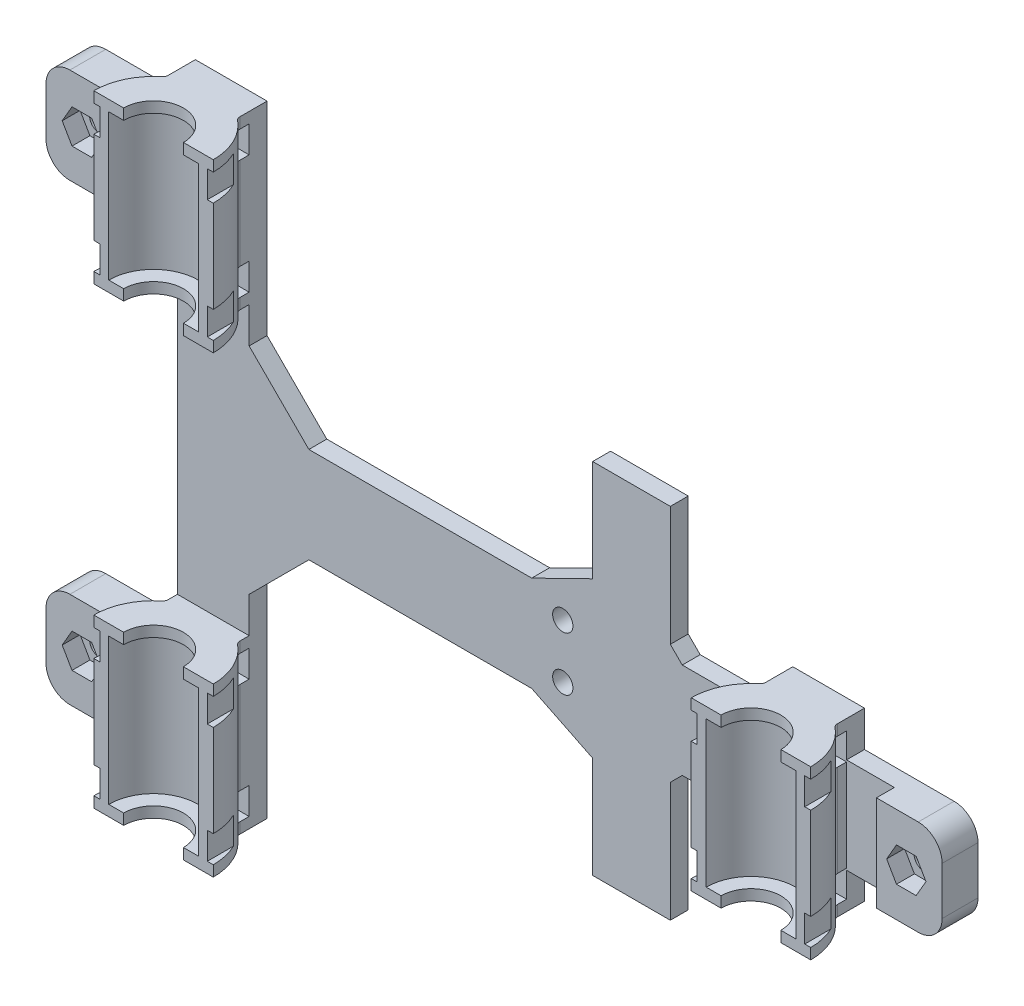
from build123d import *

# Parameters (mm, degrees)
SKETCH_1_W           = 150
SKETCH_1_H           = 140
EXTRUDE_1_DEPTH      = 3
EXTRUDE_2_DEPTH      = 14
EXTRUDE_2_DEPTH_BACK = 14
EXTRUDE_START        = 38
EXTRUDE_3_DEPTH      = 14
EXTRUDE_START_2      = 52
EXTRUDE_5_DEPTH      = 1.8
EXTRUDE_START_3      = 24
EXTRUDE_6_DEPTH      = 1.8
EXTRUDE_START_4      = 12.2
EXTRUDE_7_DEPTH      = 1.8
EXTRUDE_START_5      = -14
EXTRUDE_8_DEPTH      = 1.8
EXTRUDE_START_6      = -52
EXTRUDE_9_DEPTH      = 1.8
EXTRUDE_START_7      = -25.8
EXTRUDE_10_DEPTH     = 1.8
FILLET_1_R           = 1
CUT_EXTRUDE_5_REACH  = 105.412
SKETCH_5_W           = 1
SKETCH_5_H           = 4.5
CUT_EXTRUDE_6_REACH  = 105.078
SKETCH_3_9_R         = 1.7
CUT_EXTRUDE_7_DEPTH  = 10
EXTRUDE_START_8      = 3
SKETCH_3_12_W        = 10.254153824
SKETCH_3_12_H        = 16
EXTRUDE_11_DEPTH     = 3
CUT_EXTRUDE_START    = -15
SKETCH_6_W           = 2
SKETCH_6_H           = 4.5
CUT_EXTRUDE_8_DEPTH  = 20
CUT_EXTRUDE_START_2  = -115
SKETCH_6_3_W         = 2
SKETCH_6_3_H         = 4.5
CUT_EXTRUDE_9_DEPTH  = 20
CHAMFER_2_SIZE       = 2
FILLET_2_R           = 4
EXTRUDE_12_DEPTH     = 24
CUT_EXTRUDE_10_DEPTH = 10
SKETCH_8_W           = 8
SKETCH_8_H           = 2.4
CUT_EXTRUDE_11_DEPTH = 10
CHAMFER_1_SIZE       = 10.2
CHAMFER_1_SIZE2      = 5
CHAMFER_3_SIZE       = 5
CHAMFER_3_SIZE2      = 10.2
SKETCH_9_OUTSIDE_W   = 188.902
SKETCH_9_OUTSIDE_H   = 65.902
CUT_EXTRUDE_13_DEPTH = 132.034346642


with BuildPart() as part:
    # 草图1 → 凸台-拉伸1 (new body)
    with BuildSketch(Plane.XY):
        Rectangle(SKETCH_1_W, SKETCH_1_H)
    extrude(amount=EXTRUDE_1_DEPTH)

    # 草图2 → 凸台-拉伸2 (add, two sides: drawn at the far end of the back side and taken through both)
    with BuildSketch(Plane(origin=(0, 0, 0), x_dir=(1, 0, 0), z_dir=(0, 1, 0)).offset(-EXTRUDE_2_DEPTH_BACK)):
        with BuildLine():
            Line((56, -5), (56, -3))
            Line((56, -3), (44, -3))
            Line((44, -3), (44, -5))
            ThreePointArc((44, -5), (41.05572809, -8.527864045), (40, -13))
            Line((40, -13), (42.5, -13))
            ThreePointArc((42.5, -13), (50, -5.5), (57.5, -13))
            Line((57.5, -13), (60, -13))
            ThreePointArc((60, -13), (58.94427191, -8.527864045), (56, -5))
        make_face()
    extrude(amount=EXTRUDE_2_DEPTH + EXTRUDE_2_DEPTH_BACK)

    # 草图2<3> → 凸台-拉伸3 (add, symmetric)
    with BuildSketch(Plane(origin=(0, 0, 0), x_dir=(1, 0, 0), z_dir=(0, 1, 0)).offset(EXTRUDE_START)):
        with BuildLine():
            Line((-60, -13), (-57.5, -13))
            ThreePointArc((-57.5, -13), (-50, -5.5), (-42.5, -13))
            Line((-42.5, -13), (-40, -13))
            ThreePointArc((-40, -13), (-41.05572809, -8.527864045), (-44, -5))
            Line((-44, -5), (-44, -3))
            Line((-44, -3), (-56, -3))
            Line((-56, -3), (-56, -5))
            ThreePointArc((-56, -5), (-58.94427191, -8.527864045), (-60, -13))
        make_face()
    extrude_3 = extrude(amount=EXTRUDE_3_DEPTH, both=True)

    # 草图2<4> → 凸台-拉伸5 (add)
    with BuildSketch(Plane(origin=(0, 0, 0), x_dir=(1, 0, 0), z_dir=(0, 1, 0)).offset(EXTRUDE_START_2)):
        with BuildLine():
            Line((-55, -13), (-57.5, -13))
            ThreePointArc((-57.5, -13), (-50, -5.5), (-42.5, -13))
            Line((-42.5, -13), (-45, -13))
            ThreePointArc((-45, -13), (-50, -8), (-55, -13))
        make_face()
    extrude(amount=-EXTRUDE_5_DEPTH)

    # 草图2<5> → 凸台-拉伸6 (add)
    with BuildSketch(Plane(origin=(0, 0, 0), x_dir=(1, 0, 0), z_dir=(0, 1, 0)).offset(EXTRUDE_START_3)):
        with BuildLine():
            Line((-55, -13), (-57.5, -13))
            ThreePointArc((-57.5, -13), (-50, -5.5), (-42.5, -13))
            Line((-42.5, -13), (-45, -13))
            ThreePointArc((-45, -13), (-50, -8), (-55, -13))
        make_face()
    extrude(amount=EXTRUDE_6_DEPTH)

    # 草图2<6> → 凸台-拉伸7 (add)
    with BuildSketch(Plane(origin=(0, 0, 0), x_dir=(1, 0, 0), z_dir=(0, 1, 0)).offset(EXTRUDE_START_4)):
        with BuildLine():
            Line((55, -13), (57.5, -13))
            ThreePointArc((57.5, -13), (50, -5.5), (42.5, -13))
            Line((42.5, -13), (45, -13))
            ThreePointArc((45, -13), (50, -8), (55, -13))
        make_face()
    extrude(amount=EXTRUDE_7_DEPTH)

    # 镜向5: 凸台-拉伸3 across plane
    add(extrude_3.mirror(Plane.ZX))

    # 草图2<7> → 凸台-拉伸8 (add)
    with BuildSketch(Plane(origin=(0, 0, 0), x_dir=(1, 0, 0), z_dir=(0, 1, 0)).offset(EXTRUDE_START_5)):
        with BuildLine():
            Line((55, -13), (57.5, -13))
            ThreePointArc((57.5, -13), (50, -5.5), (42.5, -13))
            Line((42.5, -13), (45, -13))
            ThreePointArc((45, -13), (50, -8), (55, -13))
        make_face()
    extrude(amount=EXTRUDE_8_DEPTH)

    # 草图2<8> → 凸台-拉伸9 (add)
    with BuildSketch(Plane(origin=(0, 0, 0), x_dir=(1, 0, 0), z_dir=(0, 1, 0)).offset(EXTRUDE_START_6)):
        with BuildLine():
            Line((-55, -13), (-57.5, -13))
            ThreePointArc((-57.5, -13), (-50, -5.5), (-42.5, -13))
            Line((-42.5, -13), (-45, -13))
            ThreePointArc((-45, -13), (-50, -8), (-55, -13))
        make_face()
    extrude(amount=EXTRUDE_9_DEPTH)

    # 草图2<9> → 凸台-拉伸10 (add)
    with BuildSketch(Plane(origin=(0, 0, 0), x_dir=(1, 0, 0), z_dir=(0, 1, 0)).offset(EXTRUDE_START_7)):
        with BuildLine():
            Line((-55, -13), (-57.5, -13))
            ThreePointArc((-57.5, -13), (-50, -5.5), (-42.5, -13))
            Line((-42.5, -13), (-45, -13))
            ThreePointArc((-45, -13), (-50, -8), (-55, -13))
        make_face()
    extrude(amount=EXTRUDE_10_DEPTH)

    # 圆角1
    fillet_1_edges = [part.edges().sort_by_distance(p)[0] for p in [
        (56, 0, 5),
        (44, 0, 5),
        (-44, 38, 5),
        (-56, 38, 5),
        (-56, -38, 5),
        (-44, -38, 5),
    ]]
    fillet(fillet_1_edges, radius=FILLET_1_R)

    # 草图5 → 切除-拉伸5 (cut, up to next)
    with BuildSketch(Plane.XY.offset(13), mode=Mode.PRIVATE) as cut_extrude_5_sk1:
        with Locations((59.5, 9.95)):
            Rectangle(SKETCH_5_W, SKETCH_5_H)
    cut_extrude_5_tool1 = extrude(cut_extrude_5_sk1.sketch, amount=-CUT_EXTRUDE_5_REACH, mode=Mode.PRIVATE) & part.part
    # 草图5 → 切除-拉伸5 (cut, up to next)
    with BuildSketch(Plane.XY.offset(13), mode=Mode.PRIVATE) as cut_extrude_5_sk2:
        with Locations((59.5, -9.95)):
            Rectangle(SKETCH_5_W, SKETCH_5_H)
    cut_extrude_5_tool2 = extrude(cut_extrude_5_sk2.sketch, amount=-CUT_EXTRUDE_5_REACH, mode=Mode.PRIVATE) & part.part
    # 草图5 → 切除-拉伸5 (cut, up to next)
    with BuildSketch(Plane.XY.offset(13), mode=Mode.PRIVATE) as cut_extrude_5_sk3:
        with Locations((-59.5, 47.95)):
            Rectangle(SKETCH_5_W, SKETCH_5_H)
    cut_extrude_5_tool3 = extrude(cut_extrude_5_sk3.sketch, amount=-CUT_EXTRUDE_5_REACH, mode=Mode.PRIVATE) & part.part
    # 草图5 → 切除-拉伸5 (cut, up to next)
    with BuildSketch(Plane.XY.offset(13), mode=Mode.PRIVATE) as cut_extrude_5_sk4:
        with Locations((-59.5, 28.05)):
            Rectangle(SKETCH_5_W, SKETCH_5_H)
    cut_extrude_5_tool4 = extrude(cut_extrude_5_sk4.sketch, amount=-CUT_EXTRUDE_5_REACH, mode=Mode.PRIVATE) & part.part
    # 草图5 → 切除-拉伸5 (cut, up to next)
    with BuildSketch(Plane.XY.offset(13), mode=Mode.PRIVATE) as cut_extrude_5_sk5:
        with Locations((-59.5, -28.05)):
            Rectangle(SKETCH_5_W, SKETCH_5_H)
    cut_extrude_5_tool5 = extrude(cut_extrude_5_sk5.sketch, amount=-CUT_EXTRUDE_5_REACH, mode=Mode.PRIVATE) & part.part
    # 草图5 → 切除-拉伸5 (cut, up to next)
    with BuildSketch(Plane.XY.offset(13), mode=Mode.PRIVATE) as cut_extrude_5_sk6:
        with Locations((-59.5, -47.95)):
            Rectangle(SKETCH_5_W, SKETCH_5_H)
    cut_extrude_5_tool6 = extrude(cut_extrude_5_sk6.sketch, amount=-CUT_EXTRUDE_5_REACH, mode=Mode.PRIVATE) & part.part
    # 草图5 → 切除-拉伸5 (cut, up to next)
    with BuildSketch(Plane.XY.offset(13), mode=Mode.PRIVATE) as cut_extrude_5_sk7:
        with Locations((-40.5, -47.95)):
            Rectangle(SKETCH_5_W, SKETCH_5_H)
    cut_extrude_5_tool7 = extrude(cut_extrude_5_sk7.sketch, amount=-CUT_EXTRUDE_5_REACH, mode=Mode.PRIVATE) & part.part
    # 草图5 → 切除-拉伸5 (cut, up to next)
    with BuildSketch(Plane.XY.offset(13), mode=Mode.PRIVATE) as cut_extrude_5_sk8:
        with Locations((-40.5, -28.05)):
            Rectangle(SKETCH_5_W, SKETCH_5_H)
    cut_extrude_5_tool8 = extrude(cut_extrude_5_sk8.sketch, amount=-CUT_EXTRUDE_5_REACH, mode=Mode.PRIVATE) & part.part
    # 草图5 → 切除-拉伸5 (cut, up to next)
    with BuildSketch(Plane.XY.offset(13), mode=Mode.PRIVATE) as cut_extrude_5_sk9:
        with Locations((-40.5, 28.05)):
            Rectangle(SKETCH_5_W, SKETCH_5_H)
    cut_extrude_5_tool9 = extrude(cut_extrude_5_sk9.sketch, amount=-CUT_EXTRUDE_5_REACH, mode=Mode.PRIVATE) & part.part
    # 草图5 → 切除-拉伸5 (cut, up to next)
    with BuildSketch(Plane.XY.offset(13), mode=Mode.PRIVATE) as cut_extrude_5_sk10:
        with Locations((-40.5, 47.95)):
            Rectangle(SKETCH_5_W, SKETCH_5_H)
    cut_extrude_5_tool10 = extrude(cut_extrude_5_sk10.sketch, amount=-CUT_EXTRUDE_5_REACH, mode=Mode.PRIVATE) & part.part
    # 草图5 → 切除-拉伸5 (cut, up to next)
    with BuildSketch(Plane.XY.offset(13), mode=Mode.PRIVATE) as cut_extrude_5_sk11:
        with Locations((40.5, -9.95)):
            Rectangle(SKETCH_5_W, SKETCH_5_H)
    cut_extrude_5_tool11 = extrude(cut_extrude_5_sk11.sketch, amount=-CUT_EXTRUDE_5_REACH, mode=Mode.PRIVATE) & part.part
    # 草图5 → 切除-拉伸5 (cut, up to next)
    with BuildSketch(Plane.XY.offset(13), mode=Mode.PRIVATE) as cut_extrude_5_sk12:
        with Locations((40.5, 9.95)):
            Rectangle(SKETCH_5_W, SKETCH_5_H)
    cut_extrude_5_tool12 = extrude(cut_extrude_5_sk12.sketch, amount=-CUT_EXTRUDE_5_REACH, mode=Mode.PRIVATE) & part.part
    add(cut_extrude_5_tool1.solids().sort_by_distance((59.5, 9.95, 13))[0], mode=Mode.SUBTRACT)
    add(cut_extrude_5_tool2.solids().sort_by_distance((59.5, -9.95, 13))[0], mode=Mode.SUBTRACT)
    add(cut_extrude_5_tool3.solids().sort_by_distance((-59.5, 47.95, 13))[0], mode=Mode.SUBTRACT)
    add(cut_extrude_5_tool4.solids().sort_by_distance((-59.5, 28.05, 13))[0], mode=Mode.SUBTRACT)
    add(cut_extrude_5_tool5.solids().sort_by_distance((-59.5, -28.05, 13))[0], mode=Mode.SUBTRACT)
    add(cut_extrude_5_tool6.solids().sort_by_distance((-59.5, -47.95, 13))[0], mode=Mode.SUBTRACT)
    add(cut_extrude_5_tool7.solids().sort_by_distance((-40.5, -47.95, 13))[0], mode=Mode.SUBTRACT)
    add(cut_extrude_5_tool8.solids().sort_by_distance((-40.5, -28.05, 13))[0], mode=Mode.SUBTRACT)
    add(cut_extrude_5_tool9.solids().sort_by_distance((-40.5, 28.05, 13))[0], mode=Mode.SUBTRACT)
    add(cut_extrude_5_tool10.solids().sort_by_distance((-40.5, 47.95, 13))[0], mode=Mode.SUBTRACT)
    add(cut_extrude_5_tool11.solids().sort_by_distance((40.5, -9.95, 13))[0], mode=Mode.SUBTRACT)
    add(cut_extrude_5_tool12.solids().sort_by_distance((40.5, 9.95, 13))[0], mode=Mode.SUBTRACT)

    # 草图3 → 切除-拉伸6 (cut, up to next)
    with BuildSketch(Plane.XY.offset(3), mode=Mode.PRIVATE) as cut_extrude_6_sk1:
        with BuildLine():
            Line((-56, 46), (-56, 52))
            Line((-56, 52), (-44, 52))
            Line((-44, 52), (-44, 18))
            Line((-44, 18), (-34, 8))
            Line((-34, 8), (13.5, 8))
            Line((13.5, 8), (13.5, 30))
            Line((13.5, 30), (26.5, 30))
            Line((26.5, 30), (26.5, 8))
            Line((26.5, 8), (44, 8))
            Line((44, 8), (44, 14))
            Line((44, 14), (56, 14))
            Line((56, 14), (56, 8))
            Line((56, 8), (71, 8))
            ThreePointArc((71, 8), (73.828427125, 6.828427125), (75, 4))
            Line((75, 4), (75, 70))
            Line((75, 70), (-75, 70))
            Line((-75, 70), (-75, 42))
            ThreePointArc((-75, 42), (-73.828427125, 44.828427125), (-71, 46))
            Line((-71, 46), (-56, 46))
        make_face()
    cut_extrude_6_tool1 = extrude(cut_extrude_6_sk1.sketch, amount=-CUT_EXTRUDE_6_REACH, mode=Mode.PRIVATE) & part.part
    # 草图3 → 切除-拉伸6 (cut, up to next)
    with BuildSketch(Plane.XY.offset(3), mode=Mode.PRIVATE) as cut_extrude_6_sk2:
        with BuildLine():
            Line((-56, -30), (-56, 30))
            Line((-56, 30), (-71, 30))
            ThreePointArc((-71, 30), (-73.828427125, 31.171572875), (-75, 34))
            Line((-75, 34), (-75, -34))
            ThreePointArc((-75, -34), (-73.828427125, -31.171572875), (-71, -30))
            Line((-71, -30), (-56, -30))
        make_face()
    cut_extrude_6_tool2 = extrude(cut_extrude_6_sk2.sketch, amount=-CUT_EXTRUDE_6_REACH, mode=Mode.PRIVATE) & part.part
    # 草图3 → 切除-拉伸6 (cut, up to next)
    with BuildSketch(Plane.XY.offset(3), mode=Mode.PRIVATE) as cut_extrude_6_sk3:
        with BuildLine():
            Line((-44, -18), (-44, -52))
            Line((-44, -52), (-56, -52))
            Line((-56, -52), (-56, -46))
            Line((-56, -46), (-71, -46))
            ThreePointArc((-71, -46), (-73.828427125, -44.828427125), (-75, -42))
            Line((-75, -42), (-75, -70))
            Line((-75, -70), (75, -70))
            Line((75, -70), (75, -4))
            ThreePointArc((75, -4), (73.828427125, -6.828427125), (71, -8))
            Line((71, -8), (56, -8))
            Line((56, -8), (56, -14))
            Line((56, -14), (44, -14))
            Line((44, -14), (44, -8))
            Line((44, -8), (26.5, -8))
            Line((26.5, -8), (26.5, -30))
            Line((26.5, -30), (13.5, -30))
            Line((13.5, -30), (13.5, -8))
            Line((13.5, -8), (-34, -8))
            Line((-34, -8), (-44, -18))
        make_face()
    cut_extrude_6_tool3 = extrude(cut_extrude_6_sk3.sketch, amount=-CUT_EXTRUDE_6_REACH, mode=Mode.PRIVATE) & part.part
    add(cut_extrude_6_tool1.solids().sort_by_distance((8.681591, 41.934656, 3))[0], mode=Mode.SUBTRACT)
    add(cut_extrude_6_tool2.solids().sort_by_distance((-65.551535, 0, 3))[0], mode=Mode.SUBTRACT)
    add(cut_extrude_6_tool3.solids().sort_by_distance((8.681591, -41.934656, 3))[0], mode=Mode.SUBTRACT)

    # 草图3<9> → 切除-拉伸7 (cut)
    with BuildSketch(Plane.XY.offset(3)):
        with Locations((-69, 38)):
            Circle(SKETCH_3_9_R)
        with Locations((-69, -38)):
            Circle(SKETCH_3_9_R)
        with Locations((69, 0)):
            Circle(SKETCH_3_9_R)
        with Locations((8.5, -4.5)):
            Circle(SKETCH_3_9_R)
        with Locations((8.5, 4.5)):
            Circle(SKETCH_3_9_R)
    extrude(amount=-CUT_EXTRUDE_7_DEPTH, mode=Mode.SUBTRACT)

    # 草图3<12> → 凸台-拉伸11 (add)
    # profile 1 of 4: a face of its own
    with BuildSketch(Plane.XY.offset(3).offset(EXTRUDE_START_8)):
        with BuildLine():
            Line((64, 8), (64, -8))
            Line((64, -8), (71, -8))
            ThreePointArc((71, -8), (73.828427125, -6.828427125), (75, -4))
            Line((75, -4), (75, 4))
            ThreePointArc((75, 4), (73.828427125, 6.828427125), (71, 8))
            Line((71, 8), (64, 8))
        make_face()
        Polygon((70.645448267, 2.85), (72.290896534, 0), (70.645448267, -2.85), (67.354551733, -2.85), (65.709103466, 0), (67.354551733, 2.85), align=None, mode=Mode.SUBTRACT)
    # profile 2 of 4: a face of its own
    with BuildSketch(Plane.XY.offset(3).offset(EXTRUDE_START_8)):
        with BuildLine():
            Line((-64, 30), (-64, 46))
            Line((-64, 46), (-71, 46))
            ThreePointArc((-71, 46), (-73.828427125, 44.828427125), (-75, 42))
            Line((-75, 42), (-75, 34))
            ThreePointArc((-75, 34), (-73.828427125, 31.171572875), (-71, 30))
            Line((-71, 30), (-64, 30))
        make_face()
        Polygon((-67.354551733, 40.85), (-65.709103466, 38), (-67.354551733, 35.15), (-70.645448267, 35.15), (-72.290896534, 38), (-70.645448267, 40.85), align=None, mode=Mode.SUBTRACT)
    # profile 3 of 4: a face of its own
    with BuildSketch(Plane.XY.offset(3).offset(EXTRUDE_START_8)):
        with Locations((8.372923088, 0)):
            Rectangle(SKETCH_3_12_W, SKETCH_3_12_H)
        Polygon((10.145448267, -1.65), (11.790896534, -4.5), (10.145448267, -7.35), (6.854551733, -7.35), (5.209103466, -4.5), (6.854551733, -1.65), align=None, mode=Mode.SUBTRACT)
        Polygon((6.854551733, 7.35), (10.145448267, 7.35), (11.790896534, 4.5), (10.145448267, 1.65), (6.854551733, 1.65), (5.209103466, 4.5), align=None, mode=Mode.SUBTRACT)
    # profile 4 of 4: a face of its own
    with BuildSketch(Plane.XY.offset(3).offset(EXTRUDE_START_8)):
        with BuildLine():
            Line((-64, -46), (-64, -30))
            Line((-64, -30), (-71, -30))
            ThreePointArc((-71, -30), (-73.828427125, -31.171572875), (-75, -34))
            Line((-75, -34), (-75, -42))
            ThreePointArc((-75, -42), (-73.828427125, -44.828427125), (-71, -46))
            Line((-71, -46), (-64, -46))
        make_face()
        Polygon((-70.645448267, -35.15), (-67.354551733, -35.15), (-65.709103466, -38), (-67.354551733, -40.85), (-70.645448267, -40.85), (-72.290896534, -38), align=None, mode=Mode.SUBTRACT)
    extrude(amount=-EXTRUDE_11_DEPTH)

    # 草图6 → 切除-拉伸8 (cut)
    with BuildSketch(Plane(origin=(75, 0, 0), x_dir=(0, 0, -1), z_dir=(1, 0, 0)).offset(CUT_EXTRUDE_START)):
        with Locations((-4, 9.95)):
            Rectangle(SKETCH_6_W, SKETCH_6_H)
        with Locations((-4, -9.95)):
            Rectangle(SKETCH_6_W, SKETCH_6_H)
    extrude(amount=-CUT_EXTRUDE_8_DEPTH, mode=Mode.SUBTRACT)

    # 草图6<3> → 切除-拉伸9 (cut)
    with BuildSketch(Plane(origin=(75, 0, 0), x_dir=(0, 0, -1), z_dir=(1, 0, 0)).offset(CUT_EXTRUDE_START_2)):
        with Locations((-4, 47.95)):
            Rectangle(SKETCH_6_3_W, SKETCH_6_3_H)
        with Locations((-4, 28.05)):
            Rectangle(SKETCH_6_3_W, SKETCH_6_3_H)
        with Locations((-4, -28.05)):
            Rectangle(SKETCH_6_3_W, SKETCH_6_3_H)
        with Locations((-4, -47.95)):
            Rectangle(SKETCH_6_3_W, SKETCH_6_3_H)
    extrude(amount=-CUT_EXTRUDE_9_DEPTH, mode=Mode.SUBTRACT)

    # 倒角2
    chamfer_2_edges = [part.edges().sort_by_distance(p)[0] for p in [
        (44, 8, 1.5),
        (26.5, 8, 1.5),
        (26.5, -8, 1.5),
        (44, -8, 1.5),
    ]]
    chamfer(chamfer_2_edges, length=CHAMFER_2_SIZE)

    # 圆角2
    # the kernel refuses this fillet: 4 mm, written as the material it takes off along each edge
    with BuildSketch(Plane(origin=(56.125641957, 7.7, 5), x_dir=(0.7056664326282083, 0, 0.7085442017699237), z_dir=(0, 1, 0)), Plane(origin=(43.874358043, 12.2, 5), x_dir=(-0.7056664326282107, 0, 0.7085442017699214), z_dir=(0, -1, 0)), Plane(origin=(56.125641957, -12.2, 5), x_dir=(0.7056664326282083, 0, 0.7085442017699237), z_dir=(0, 1, 0)), Plane(origin=(43.874358043, -7.7, 5), x_dir=(-0.7056664326282107, 0, 0.7085442017699214), z_dir=(0, -1, 0)), Plane(origin=(-56.125641957, -25.8, 5), x_dir=(-0.7056664326282412, 0, 0.7085442017698909), z_dir=(0, -1, 0)), Plane(origin=(-43.874358043, -30.3, 5), x_dir=(0.7056664326282412, 0, 0.7085442017698909), z_dir=(0, 1, 0)), Plane(origin=(-56.125641957, -45.7, 5), x_dir=(-0.7056664326282412, 0, 0.7085442017698909), z_dir=(0, -1, 0)), Plane(origin=(-43.874358043, -50.2, 5), x_dir=(0.7056664326282412, 0, 0.7085442017698909), z_dir=(0, 1, 0))) as fillet_2_piece_1:
        with BuildLine():
            CenterArc((1.667353126, -3.994247821), FILLET_2_R, 86.926905589, 48.189685104)
            Line((-1.166823682, -1.17158209), (-1.450241362, -0.889315517))
            Line((-1.450241362, -0.889315517), (-0.283417681, 0.282266573))
            Line((-0.283417681, 0.282266573), (0.109264727, 0.384787239))
            ThreePointArc((0.109264727, 0.384787239), (0.331663557, 0.364826953), (1.903236699, 0.399424782))
            Line((1.903236699, 0.399424782), (1.881792738, 0))
        make_face()
    extrude(amount=4.5, mode=Mode.SUBTRACT)
    with BuildSketch(Plane(origin=(-43.874358043, 50.2, 5), x_dir=(0.7056664326282412, 0, 0.7085442017698909), z_dir=(0, -1, 0)), Plane(origin=(-56.125641957, 45.7, 5), x_dir=(-0.7056664326282412, 0, 0.7085442017698909), z_dir=(0, 1, 0)), Plane(origin=(-43.874358043, 30.3, 5), x_dir=(0.7056664326282412, 0, 0.7085442017698909), z_dir=(0, -1, 0)), Plane(origin=(-56.125641957, 25.8, 5), x_dir=(-0.7056664326282412, 0, 0.7085442017698909), z_dir=(0, 1, 0))) as fillet_2_piece_2:
        with BuildLine():
            CenterArc((1.667353126, 3.994247821), FILLET_2_R, 224.883409306, 48.189685104)
            Line((-1.166823682, 1.17158209), (-1.450241362, 0.889315517))
            Line((-1.450241362, 0.889315517), (-0.283417681, -0.282266573))
            Line((-0.283417681, -0.282266573), (0.109264727, -0.384787239))
            ThreePointArc((0.109264727, -0.384787239), (0.331663557, -0.364826953), (1.903236699, -0.399424782))
            Line((1.903236699, -0.399424782), (1.881792738, 0))
        make_face()
    extrude(amount=4.5, mode=Mode.SUBTRACT)

    # 草图3<13> → 凸台-拉伸12 (add)
    with BuildSketch(Plane.XY.offset(3)):
        Polygon((26.5, 8), (26.5, -8), (26.5, -30), (13.5, -30), (13.5, -8), (13.5, 8), (13.5, 30), (26.5, 30), align=None)
    extrude(amount=EXTRUDE_12_DEPTH)

    # 草图7 → 切除-拉伸10 (cut)
    with BuildSketch(Plane.ZY.offset(-13.5)):
        with BuildLine():
            Line((21, -6.01), (21, -6))
            Line((21, -6), (19, -6))
            Line((19, -6), (19, -30))
            Line((19, -30), (21, -30))
            Line((21, -30), (21, -29.31))
            ThreePointArc((21, -29.31), (20.926776695, -29.133223305), (20.75, -29.06))
            Line((20.75, -29.06), (20.05, -29.06))
            ThreePointArc((20.05, -29.06), (19.873223305, -28.986776695), (19.8, -28.81))
            Line((19.8, -28.81), (19.8, -28.51))
            ThreePointArc((19.8, -28.51), (19.873223305, -28.333223305), (20.05, -28.26))
            Line((20.05, -28.26), (20.75, -28.26))
            ThreePointArc((20.75, -28.26), (20.926776695, -28.186776695), (21, -28.01))
            Line((21, -28.01), (21, -27.31))
            ThreePointArc((21, -27.31), (20.926776695, -27.133223305), (20.75, -27.06))
            Line((20.75, -27.06), (20.05, -27.06))
            ThreePointArc((20.05, -27.06), (19.873223305, -26.986776695), (19.8, -26.81))
            Line((19.8, -26.81), (19.8, -26.51))
            ThreePointArc((19.8, -26.51), (19.873223305, -26.333223305), (20.05, -26.26))
            Line((20.05, -26.26), (20.75, -26.26))
            ThreePointArc((20.75, -26.26), (20.926776695, -26.186776695), (21, -26.01))
            Line((21, -26.01), (21, -25.31))
            ThreePointArc((21, -25.31), (20.926776695, -25.133223305), (20.75, -25.06))
            Line((20.75, -25.06), (20.05, -25.06))
            ThreePointArc((20.05, -25.06), (19.873223305, -24.986776695), (19.8, -24.81))
            Line((19.8, -24.81), (19.8, -24.51))
            ThreePointArc((19.8, -24.51), (19.873223305, -24.333223305), (20.05, -24.26))
            Line((20.05, -24.26), (20.75, -24.26))
            ThreePointArc((20.75, -24.26), (20.926776695, -24.186776695), (21, -24.01))
            Line((21, -24.01), (21, -23.31))
            ThreePointArc((21, -23.31), (20.926776695, -23.133223305), (20.75, -23.06))
            Line((20.75, -23.06), (20.05, -23.06))
            ThreePointArc((20.05, -23.06), (19.873223305, -22.986776695), (19.8, -22.81))
            Line((19.8, -22.81), (19.8, -22.51))
            ThreePointArc((19.8, -22.51), (19.873223305, -22.333223305), (20.05, -22.26))
            Line((20.05, -22.26), (20.75, -22.26))
            ThreePointArc((20.75, -22.26), (20.926776695, -22.186776695), (21, -22.01))
            Line((21, -22.01), (21, -21.31))
            ThreePointArc((21, -21.31), (20.926776695, -21.133223305), (20.75, -21.06))
            Line((20.75, -21.06), (20.05, -21.06))
            ThreePointArc((20.05, -21.06), (19.873223305, -20.986776695), (19.8, -20.81))
            Line((19.8, -20.81), (19.8, -20.51))
            ThreePointArc((19.8, -20.51), (19.873223305, -20.333223305), (20.05, -20.26))
            Line((20.05, -20.26), (20.75, -20.26))
            ThreePointArc((20.75, -20.26), (20.926776695, -20.186776695), (21, -20.01))
            Line((21, -20.01), (21, -19.31))
            ThreePointArc((21, -19.31), (20.926776695, -19.133223305), (20.75, -19.06))
            Line((20.75, -19.06), (20.05, -19.06))
            ThreePointArc((20.05, -19.06), (19.873223305, -18.986776695), (19.8, -18.81))
            Line((19.8, -18.81), (19.8, -18.51))
            ThreePointArc((19.8, -18.51), (19.873223305, -18.333223305), (20.05, -18.26))
            Line((20.05, -18.26), (20.75, -18.26))
            ThreePointArc((20.75, -18.26), (20.926776695, -18.186776695), (21, -18.01))
            Line((21, -18.01), (21, -17.31))
            ThreePointArc((21, -17.31), (20.926776695, -17.133223305), (20.75, -17.06))
            Line((20.75, -17.06), (20.05, -17.06))
            ThreePointArc((20.05, -17.06), (19.873223305, -16.986776695), (19.8, -16.81))
            Line((19.8, -16.81), (19.8, -16.51))
            ThreePointArc((19.8, -16.51), (19.873223305, -16.333223305), (20.05, -16.26))
            Line((20.05, -16.26), (20.75, -16.26))
            ThreePointArc((20.75, -16.26), (20.926776695, -16.186776695), (21, -16.01))
            Line((21, -16.01), (21, -15.31))
            ThreePointArc((21, -15.31), (20.926776695, -15.133223305), (20.75, -15.06))
            Line((20.75, -15.06), (20.05, -15.06))
            ThreePointArc((20.05, -15.06), (19.873223305, -14.986776695), (19.8, -14.81))
            Line((19.8, -14.81), (19.8, -14.51))
            ThreePointArc((19.8, -14.51), (19.873223305, -14.333223305), (20.05, -14.26))
            Line((20.05, -14.26), (20.75, -14.26))
            ThreePointArc((20.75, -14.26), (20.926776695, -14.186776695), (21, -14.01))
            Line((21, -14.01), (21, -13.31))
            ThreePointArc((21, -13.31), (20.926776695, -13.133223305), (20.75, -13.06))
            Line((20.75, -13.06), (20.05, -13.06))
            ThreePointArc((20.05, -13.06), (19.873223305, -12.986776695), (19.8, -12.81))
            Line((19.8, -12.81), (19.8, -12.51))
            ThreePointArc((19.8, -12.51), (19.873223305, -12.333223305), (20.05, -12.26))
            Line((20.05, -12.26), (20.75, -12.26))
            ThreePointArc((20.75, -12.26), (20.926776695, -12.186776695), (21, -12.01))
            Line((21, -12.01), (21, -11.31))
            ThreePointArc((21, -11.31), (20.926776695, -11.133223305), (20.75, -11.06))
            Line((20.75, -11.06), (20.05, -11.06))
            ThreePointArc((20.05, -11.06), (19.873223305, -10.986776695), (19.8, -10.81))
            Line((19.8, -10.81), (19.8, -10.51))
            ThreePointArc((19.8, -10.51), (19.873223305, -10.333223305), (20.05, -10.26))
            Line((20.05, -10.26), (20.75, -10.26))
            ThreePointArc((20.75, -10.26), (20.926776695, -10.186776695), (21, -10.01))
            Line((21, -10.01), (21, -9.31))
            ThreePointArc((21, -9.31), (20.926776695, -9.133223305), (20.75, -9.06))
            Line((20.75, -9.06), (20.05, -9.06))
            ThreePointArc((20.05, -9.06), (19.873223305, -8.986776695), (19.8, -8.81))
            Line((19.8, -8.81), (19.8, -8.51))
            ThreePointArc((19.8, -8.51), (19.873223305, -8.333223305), (20.05, -8.26))
            Line((20.05, -8.26), (20.75, -8.26))
            ThreePointArc((20.75, -8.26), (20.926776695, -8.186776695), (21, -8.01))
            Line((21, -8.01), (21, -7.31))
            ThreePointArc((21, -7.31), (20.926776695, -7.133223305), (20.75, -7.06))
            Line((20.75, -7.06), (20.05, -7.06))
            ThreePointArc((20.05, -7.06), (19.873223305, -6.986776695), (19.8, -6.81))
            Line((19.8, -6.81), (19.8, -6.51))
            ThreePointArc((19.8, -6.51), (19.873223305, -6.333223305), (20.05, -6.26))
            Line((20.05, -6.26), (20.75, -6.26))
            ThreePointArc((20.75, -6.26), (20.926776695, -6.186776695), (21, -6.01))
        make_face()
        with BuildLine():
            Line((19, 30), (19, 6))
            Line((19, 6), (21, 6))
            Line((21, 6), (21, 6.69))
            ThreePointArc((21, 6.69), (20.926776695, 6.866776695), (20.75, 6.94))
            Line((20.75, 6.94), (20.05, 6.94))
            ThreePointArc((20.05, 6.94), (19.873223305, 7.013223305), (19.8, 7.19))
            Line((19.8, 7.19), (19.8, 7.49))
            ThreePointArc((19.8, 7.49), (19.873223305, 7.666776695), (20.05, 7.74))
            Line((20.05, 7.74), (20.75, 7.74))
            ThreePointArc((20.75, 7.74), (20.926776695, 7.813223305), (21, 7.99))
            Line((21, 7.99), (21, 8.69))
            ThreePointArc((21, 8.69), (20.926776695, 8.866776695), (20.75, 8.94))
            Line((20.75, 8.94), (20.05, 8.94))
            ThreePointArc((20.05, 8.94), (19.873223305, 9.013223305), (19.8, 9.19))
            Line((19.8, 9.19), (19.8, 9.49))
            ThreePointArc((19.8, 9.49), (19.873223305, 9.666776695), (20.05, 9.74))
            Line((20.05, 9.74), (20.75, 9.74))
            ThreePointArc((20.75, 9.74), (20.926776695, 9.813223305), (21, 9.99))
            Line((21, 9.99), (21, 10.69))
            ThreePointArc((21, 10.69), (20.926776695, 10.866776695), (20.75, 10.94))
            Line((20.75, 10.94), (20.05, 10.94))
            ThreePointArc((20.05, 10.94), (19.873223305, 11.013223305), (19.8, 11.19))
            Line((19.8, 11.19), (19.8, 11.49))
            ThreePointArc((19.8, 11.49), (19.873223305, 11.666776695), (20.05, 11.74))
            Line((20.05, 11.74), (20.75, 11.74))
            ThreePointArc((20.75, 11.74), (20.926776695, 11.813223305), (21, 11.99))
            Line((21, 11.99), (21, 12.69))
            ThreePointArc((21, 12.69), (20.926776695, 12.866776695), (20.75, 12.94))
            Line((20.75, 12.94), (20.05, 12.94))
            ThreePointArc((20.05, 12.94), (19.873223305, 13.013223305), (19.8, 13.19))
            Line((19.8, 13.19), (19.8, 13.49))
            ThreePointArc((19.8, 13.49), (19.873223305, 13.666776695), (20.05, 13.74))
            Line((20.05, 13.74), (20.75, 13.74))
            ThreePointArc((20.75, 13.74), (20.926776695, 13.813223305), (21, 13.99))
            Line((21, 13.99), (21, 14.69))
            ThreePointArc((21, 14.69), (20.926776695, 14.866776695), (20.75, 14.94))
            Line((20.75, 14.94), (20.05, 14.94))
            ThreePointArc((20.05, 14.94), (19.873223305, 15.013223305), (19.8, 15.19))
            Line((19.8, 15.19), (19.8, 15.49))
            ThreePointArc((19.8, 15.49), (19.873223305, 15.666776695), (20.05, 15.74))
            Line((20.05, 15.74), (20.75, 15.74))
            ThreePointArc((20.75, 15.74), (20.926776695, 15.813223305), (21, 15.99))
            Line((21, 15.99), (21, 16.69))
            ThreePointArc((21, 16.69), (20.926776695, 16.866776695), (20.75, 16.94))
            Line((20.75, 16.94), (20.05, 16.94))
            ThreePointArc((20.05, 16.94), (19.873223305, 17.013223305), (19.8, 17.19))
            Line((19.8, 17.19), (19.8, 17.49))
            ThreePointArc((19.8, 17.49), (19.873223305, 17.666776695), (20.05, 17.74))
            Line((20.05, 17.74), (20.75, 17.74))
            ThreePointArc((20.75, 17.74), (20.926776695, 17.813223305), (21, 17.99))
            Line((21, 17.99), (21, 18.69))
            ThreePointArc((21, 18.69), (20.926776695, 18.866776695), (20.75, 18.94))
            Line((20.75, 18.94), (20.05, 18.94))
            ThreePointArc((20.05, 18.94), (19.873223305, 19.013223305), (19.8, 19.19))
            Line((19.8, 19.19), (19.8, 19.49))
            ThreePointArc((19.8, 19.49), (19.873223305, 19.666776695), (20.05, 19.74))
            Line((20.05, 19.74), (20.75, 19.74))
            ThreePointArc((20.75, 19.74), (20.926776695, 19.813223305), (21, 19.99))
            Line((21, 19.99), (21, 20.69))
            ThreePointArc((21, 20.69), (20.926776695, 20.866776695), (20.75, 20.94))
            Line((20.75, 20.94), (20.05, 20.94))
            ThreePointArc((20.05, 20.94), (19.873223305, 21.013223305), (19.8, 21.19))
            Line((19.8, 21.19), (19.8, 21.49))
            ThreePointArc((19.8, 21.49), (19.873223305, 21.666776695), (20.05, 21.74))
            Line((20.05, 21.74), (20.75, 21.74))
            ThreePointArc((20.75, 21.74), (20.926776695, 21.813223305), (21, 21.99))
            Line((21, 21.99), (21, 22.69))
            ThreePointArc((21, 22.69), (20.926776695, 22.866776695), (20.75, 22.94))
            Line((20.75, 22.94), (20.05, 22.94))
            ThreePointArc((20.05, 22.94), (19.873223305, 23.013223305), (19.8, 23.19))
            Line((19.8, 23.19), (19.8, 23.49))
            ThreePointArc((19.8, 23.49), (19.873223305, 23.666776695), (20.05, 23.74))
            Line((20.05, 23.74), (20.75, 23.74))
            ThreePointArc((20.75, 23.74), (20.926776695, 23.813223305), (21, 23.99))
            Line((21, 23.99), (21, 24.69))
            ThreePointArc((21, 24.69), (20.926776695, 24.866776695), (20.75, 24.94))
            Line((20.75, 24.94), (20.05, 24.94))
            ThreePointArc((20.05, 24.94), (19.873223305, 25.013223305), (19.8, 25.19))
            Line((19.8, 25.19), (19.8, 25.49))
            ThreePointArc((19.8, 25.49), (19.873223305, 25.666776695), (20.05, 25.74))
            Line((20.05, 25.74), (20.75, 25.74))
            ThreePointArc((20.75, 25.74), (20.926776695, 25.813223305), (21, 25.99))
            Line((21, 25.99), (21, 26.69))
            ThreePointArc((21, 26.69), (20.926776695, 26.866776695), (20.75, 26.94))
            Line((20.75, 26.94), (20.05, 26.94))
            ThreePointArc((20.05, 26.94), (19.873223305, 27.013223305), (19.8, 27.19))
            Line((19.8, 27.19), (19.8, 27.49))
            ThreePointArc((19.8, 27.49), (19.873223305, 27.666776695), (20.05, 27.74))
            Line((20.05, 27.74), (20.75, 27.74))
            ThreePointArc((20.75, 27.74), (20.926776695, 27.813223305), (21, 27.99))
            Line((21, 27.99), (21, 28.69))
            ThreePointArc((21, 28.69), (20.926776695, 28.866776695), (20.75, 28.94))
            Line((20.75, 28.94), (20.05, 28.94))
            ThreePointArc((20.05, 28.94), (19.873223305, 29.013223305), (19.8, 29.19))
            Line((19.8, 29.19), (19.8, 29.49))
            ThreePointArc((19.8, 29.49), (19.873223305, 29.666776695), (20.05, 29.74))
            Line((20.05, 29.74), (20.75, 29.74))
            ThreePointArc((20.75, 29.74), (20.926776695, 29.813223305), (21, 29.99))
            Line((21, 29.99), (21, 30))
            Line((21, 30), (19, 30))
        make_face()
    extrude(amount=-CUT_EXTRUDE_10_DEPTH, mode=Mode.SUBTRACT)

    # 草图8 → 切除-拉伸11 (cut)
    with BuildSketch(Plane.ZY.offset(-13.5)):
        with Locations((23, 7.2)):
            Rectangle(SKETCH_8_W, SKETCH_8_H)
        with Locations((23, -7.2)):
            Rectangle(SKETCH_8_W, SKETCH_8_H)
    extrude(amount=-CUT_EXTRUDE_11_DEPTH, mode=Mode.SUBTRACT)

    # 倒角1
    chamfer_1_edges = [part.edges().sort_by_distance(p)[0] for p in [
        (13.5, 8, 3),
    ]]
    chamfer_1_side = [part.faces().sort_by_distance(p)[0] for p in [
        (-6.943531022, 8, 2.032645004),
    ]]
    chamfer(chamfer_1_edges, length=CHAMFER_1_SIZE, length2=CHAMFER_1_SIZE2, reference=chamfer_1_side[0])

    # 倒角3
    chamfer_3_edges = [part.edges().sort_by_distance(p)[0] for p in [
        (13.5, -8, 3),
    ]]
    chamfer_3_side = [part.faces().sort_by_distance(p)[0] for p in [
        (13.5, -0.283783784, 11.405405405),
    ]]
    chamfer(chamfer_3_edges, length=CHAMFER_3_SIZE, length2=CHAMFER_3_SIZE2, reference=chamfer_3_side[0])

    # 草图9 outside → 切除-拉伸13 (cut, through all)
    with BuildSketch(Plane.XZ.offset(52)):
        with Locations((0, 13.5)):
            Rectangle(SKETCH_9_OUTSIDE_W, SKETCH_9_OUTSIDE_H)
        Polygon((-75, 0), (75, 0), (75, 13), (40, 13), (40, 3), (-40, 3), (-40, 13), (-75, 13), align=None, mode=Mode.SUBTRACT)
    extrude(amount=-CUT_EXTRUDE_13_DEPTH, mode=Mode.SUBTRACT)


solid = part.part
